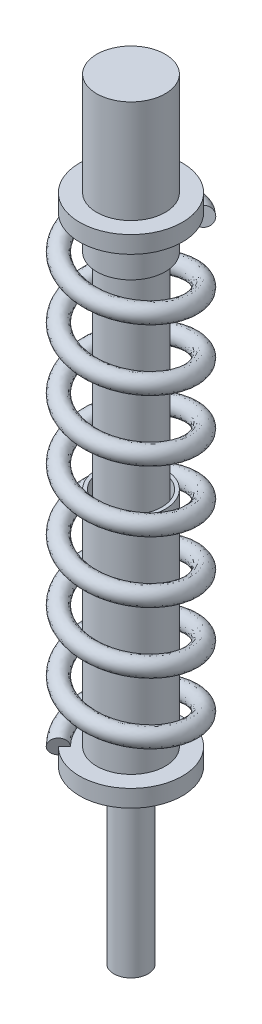
from build123d import *

# Parameters (mm, degrees)
SKETCH1_R           = 5
BOSS_EXTRUDE1_DEPTH = 50
SKETCH2_R           = 15
BOSS_EXTRUDE2_DEPTH = 5
SKETCH3_R           = 10
BOSS_EXTRUDE3_DEPTH = 65
SKETCH4_R           = 9
CUT_EXTRUDE1_DEPTH  = 60
SKETCH5_R           = 8
BOSS_EXTRUDE4_DEPTH = 120
SKETCH6_R           = 10
BOSS_EXTRUDE5_DEPTH = 10
SKETCH7_R           = 15
BOSS_EXTRUDE6_DEPTH = 5
SKETCH8_R           = 10
BOSS_EXTRUDE7_DEPTH = 30
SWEEP1_PITCH        = 17.866666667


with BuildPart() as part:
    # Sketch1 → Boss-Extrude1 (new body)
    with BuildSketch(Plane(origin=(0, 0, 0), x_dir=(1, 0, 0), z_dir=(0, 1, 0))):
        with Locations(Location((0, 0, 0), (0, 0, 270))):
            Circle(SKETCH1_R)
    extrude(amount=BOSS_EXTRUDE1_DEPTH)

    # Sketch2 → Boss-Extrude2 (add)
    with BuildSketch(Plane(origin=(0, 50, 0), x_dir=(1, 0, 0), z_dir=(0, 1, 0))):
        with Locations(Location((0, 0, 0), (0, 0, 270))):
            Circle(SKETCH2_R)
    extrude(amount=BOSS_EXTRUDE2_DEPTH)

    # Sketch3 → Boss-Extrude3 (add)
    with BuildSketch(Plane(origin=(0, 55, 0), x_dir=(1, 0, 0), z_dir=(0, 1, 0))):
        with Locations(Location((0, 0, 0), (0, 0, 270))):
            Circle(SKETCH3_R)
    extrude(amount=BOSS_EXTRUDE3_DEPTH)

    # Sketch4 → Cut-Extrude1 (cut)
    with BuildSketch(Plane(origin=(0, 120, 0), x_dir=(1, 0, 0), z_dir=(0, 1, 0))):
        with Locations(Location((0, 0, 0), (0, 0, 270))):
            Circle(SKETCH4_R)
    extrude(amount=-CUT_EXTRUDE1_DEPTH, mode=Mode.SUBTRACT)

    # Sketch5 → Boss-Extrude4 (add)
    with BuildSketch(Plane(origin=(0, 60, 0), x_dir=(1, 0, 0), z_dir=(0, 1, 0))):
        with Locations(Location((0, 0, 0), (0, 0, 270))):
            Circle(SKETCH5_R)
    extrude(amount=BOSS_EXTRUDE4_DEPTH)

    # Sketch6 → Boss-Extrude5 (add)
    with BuildSketch(Plane(origin=(0, 180, 0), x_dir=(1, 0, 0), z_dir=(0, 1, 0))):
        with Locations(Location((0, 0, 0), (0, 0, 270))):
            Circle(SKETCH6_R)
    extrude(amount=BOSS_EXTRUDE5_DEPTH)

    # Sketch7 → Boss-Extrude6 (add)
    with BuildSketch(Plane(origin=(0, 190, 0), x_dir=(1, 0, 0), z_dir=(0, 1, 0))):
        with Locations(Location((0, 0, 0), (0, 0, 270))):
            Circle(SKETCH7_R)
    extrude(amount=BOSS_EXTRUDE6_DEPTH)

    # Sketch8 → Boss-Extrude7 (add)
    with BuildSketch(Plane(origin=(0, 195, 0), x_dir=(1, 0, 0), z_dir=(0, 1, 0))):
        with Locations(Location((0, 0, 0), (0, 0, 270))):
            Circle(SKETCH8_R)
    extrude(amount=BOSS_EXTRUDE7_DEPTH)

    # Sweep1: the profile of Sweep1 profile screwed along a left-hand helix of 7.5 turns, 20 arcs to a turn; built about Z, then put on its axis
    sweep1_z = Axis((0, 0, 0), (0, 0, 1))
    sweep1_corners = [(12.5, 0, 0), (15, -0.46563508, -2.456254053), (17.5, 0, 0), (15, 0.46563508, 2.456254053)]
    with BuildLine(mode=Mode.PRIVATE) as sweep1_profile:
        ThreePointArc((12.5, 0, 0), (13.232233047, -0.329253723, -1.736833897), (15, -0.46563508, -2.456254053))
        ThreePointArc((15, -0.46563508, -2.456254053), (16.767766953, -0.329253723, -1.736833897), (17.5, 0, 0))
        ThreePointArc((17.5, 0, 0), (16.767766953, 0.329253723, 1.736833897), (15, 0.46563508, 2.456254053))
        ThreePointArc((15, 0.46563508, 2.456254053), (13.232233047, 0.329253723, 1.736833897), (12.5, 0, 0))
    sweep1_cap = Face(sweep1_profile.wire())
    sweep1_arcs = [((12.5, 0, 0), (12.5, -0.46563508, -2.456254053), (15, -0.46563508, -2.456254053), (1, 0.7071067811865476, 1)), ((15, -0.46563508, -2.456254053), (17.5, -0.46563508, -2.456254053), (17.5, 0, 0), (1, 0.7071067811865476, 1)), ((17.5, 0, 0), (17.5, 0.46563508, 2.456254053), (15, 0.46563508, 2.456254053), (1, 0.7071067811865476, 1)), ((15, 0.46563508, 2.456254053), (12.5, 0.46563508, 2.456254053), (12.5, 0, 0), (1, 0.7071067811865476, 1))]  # start, shoulder, end, weights
    sweep1_turn_angles = [0, -9, -18, -27, -36, -45, -54, -63, -72, -81, -90, -99, -108, -117, -126, -135, -144, -153, -162, -171, -180, -189, -198, -207, -216, -225, -234, -243, -252, -261, -270, -279, -288, -297, -306, -315, -324, -333, -342, -351, -360]
    sweep1_turn_weights = [1, 0.9876883405951378, 1, 0.9876883405951378, 1, 0.9876883405951378, 1, 0.9876883405951378, 1, 0.9876883405951378, 1, 0.9876883405951378, 1, 0.9876883405951378, 1, 0.9876883405951378, 1, 0.9876883405951378, 1, 0.9876883405951378, 1, 0.9876883405951378, 1, 0.9876883405951378, 1, 0.9876883405951378, 1, 0.9876883405951378, 1, 0.9876883405951378, 1, 0.9876883405951378, 1, 0.9876883405951378, 1, 0.9876883405951378, 1, 0.9876883405951378, 1, 0.9876883405951378, 1]
    sweep1_turn_sides = [Face.make_bezier_surface([[Vector(p[j][0], p[j][1], 0).rotate(sweep1_z, sweep1_turn_angles[2 * i + k]) / sweep1_turn_weights[2 * i + k] + Vector(0, 0, p[j][2] + -SWEEP1_PITCH * sweep1_turn_angles[2 * i + k] / 360) for k in range(3)] for j in range(3)], [[p[3][j] * sweep1_turn_weights[2 * i + k] for k in range(3)] for j in range(3)]) for p in sweep1_arcs for i in range(20)]
    sweep1_last_angles = [-2520, -2529, -2538, -2547, -2556, -2565, -2574, -2583, -2592, -2601, -2610, -2619, -2628, -2637, -2646, -2655, -2664, -2673, -2682, -2691, -2700]
    sweep1_last_weights = [1, 0.9876883405951378, 1, 0.9876883405951378, 1, 0.9876883405951378, 1, 0.9876883405951378, 1, 0.9876883405951378, 1, 0.9876883405951378, 1, 0.9876883405951378, 1, 0.9876883405951378, 1, 0.9876883405951378, 1, 0.9876883405951241, 1]
    sweep1_last_sides = [Face.make_bezier_surface([[Vector(p[j][0], p[j][1], 0).rotate(sweep1_z, sweep1_last_angles[2 * i + k]) / sweep1_last_weights[2 * i + k] + Vector(0, 0, p[j][2] + -SWEEP1_PITCH * sweep1_last_angles[2 * i + k] / 360) for k in range(3)] for j in range(3)], [[p[3][j] * sweep1_last_weights[2 * i + k] for k in range(3)] for j in range(3)]) for p in sweep1_arcs for i in range(10)]
    sweep1 = Plane(origin=(0, 55, 0), x_dir=(-0.7071067811865389, 0, 0.7071067811865561), z_dir=(0, 1, 0)) * Solid(Shell([*[p.moved(Location((0, 0, SWEEP1_PITCH * i))) for i in range(7) for p in sweep1_turn_sides], *sweep1_last_sides, sweep1_cap, sweep1_cap.rotate(sweep1_z, -2700).moved(Location((0, 0, -SWEEP1_PITCH * -2700 / 360)))]))
    add(sweep1)


solid = part.part
